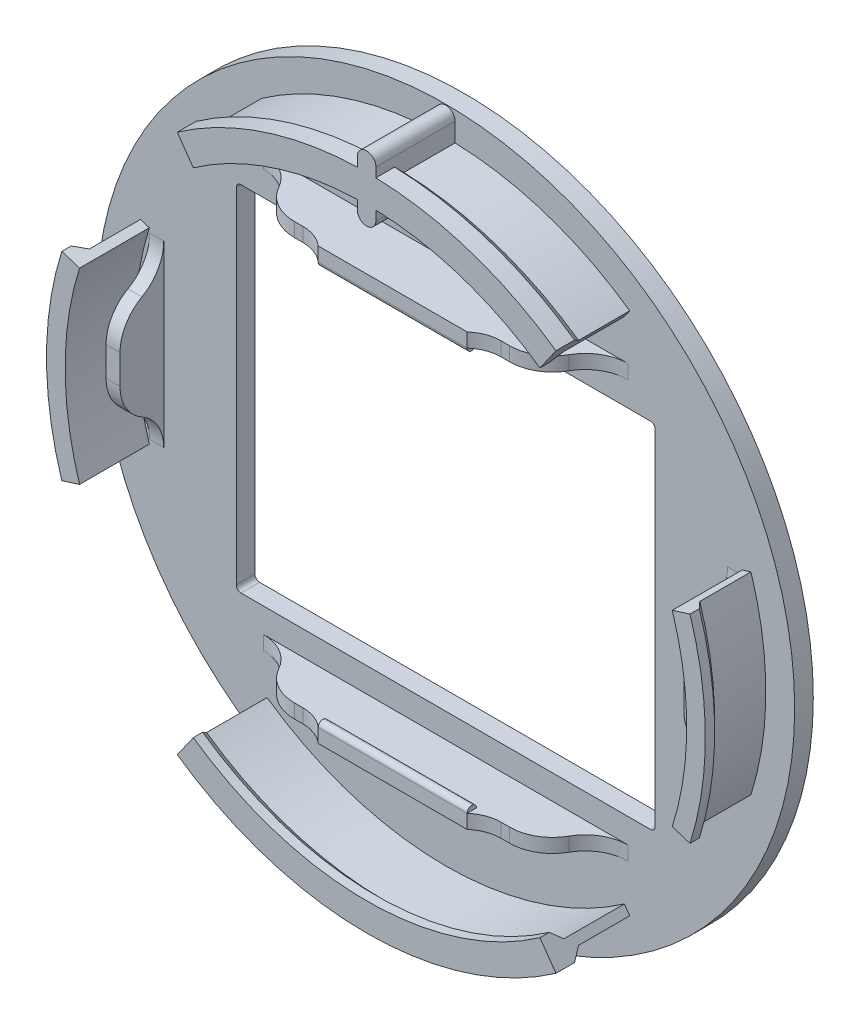
from build123d import *

# Parameters (mm, degrees)
ESQUISSE1_R        = 37.50000000000001
BOSS_EXTRU_1_DEPTH = 2
ESQUISSE2_W        = 30.000000000000004
ESQUISSE2_H        = 1.4999999999999964
ESQUISSE2_W_2      = 1.5
ESQUISSE2_H_2      = 10
EXTRU_MINCE1_DEPTH = 4.7
ESQUISSE5_W        = 16
ESQUISSE5_H        = 2.0000000000000036
BOSS_EXTRU_3_DEPTH = 1
CONG_5_R           = 0.5
CONG_6_R           = 0.5
CONG_1_R           = 4.6
CONG_2_R           = 4.6
EXTRU_MINCE2_DEPTH = 6.5
BOSS_EXTRU_2_DEPTH = 1
BOSS_EXTRU_5_DEPTH = 1
BOSS_EXTRU_4_DEPTH = 8.5
CHANFREIN1_SIZE    = 1
CONG_7_R           = 4


# Some blends are built 0.0001 mm under size
with BuildPart() as part:
    # Esquisse1 → Boss.-Extru.1 (new body)
    with BuildSketch(Plane.XY):
        Circle(ESQUISSE1_R)
        with BuildLine():
            Line((-21.999999999999996, -18.999999999999996), (22.000000000000004, -18.999999999999996))
            ThreePointArc((22.000000000000004, -18.999999999999996), (22.353553390593277, -18.85355339059327), (22.500000000000004, -18.499999999999996))
            Line((22.500000000000004, -18.499999999999996), (22.500000000000004, 18.500000000000004))
            ThreePointArc((22.500000000000004, 18.500000000000004), (22.353553390593277, 18.853553390593277), (22.000000000000004, 19.000000000000004))
            Line((22.000000000000004, 19.000000000000004), (-21.999999999999996, 19.000000000000004))
            ThreePointArc((-21.999999999999996, 19.000000000000004), (-22.35355339059327, 18.853553390593277), (-22.499999999999996, 18.500000000000004))
            Line((-22.499999999999996, 18.500000000000004), (-22.499999999999996, -18.499999999999996))
            ThreePointArc((-22.499999999999996, -18.499999999999996), (-22.35355339059327, -18.85355339059327), (-21.999999999999996, -18.999999999999996))
        make_face(mode=Mode.SUBTRACT)
    extrude(amount=BOSS_EXTRU_1_DEPTH)

    # Esquisse2 → Extru.-Mince1 (add)
    with BuildSketch(Plane.XY.offset(2)):
        with Locations((0, 22.4)):
            Rectangle(ESQUISSE2_W, ESQUISSE2_H)
        with Locations((31.05, 0)):
            Rectangle(ESQUISSE2_W_2, ESQUISSE2_H_2)
        with Locations((-31.05, 0)):
            Rectangle(ESQUISSE2_W_2, ESQUISSE2_H_2)
        with Locations((0, -22.4)):
            Rectangle(ESQUISSE2_W, ESQUISSE2_H)
    extrude(amount=EXTRU_MINCE1_DEPTH)

    # Esquisse5 → Boss.-Extru.3 (add)
    with BuildSketch(Plane.XY.offset(6.7)):
        with Locations((0, 22.15)):
            Rectangle(ESQUISSE5_W, ESQUISSE5_H)
        with Locations((0, -22.15)):
            Rectangle(ESQUISSE5_W, ESQUISSE5_H)
    extrude(amount=BOSS_EXTRU_3_DEPTH)

    # Congé5
    # the kernel refuses this fillet: 0.5 mm, written as the material it takes off along each edge
    with BuildSketch(Plane(origin=(9.25, 21.15, 6.7), x_dir=(0, 1, 0), z_dir=(-1, 0, 0))) as cong_5_piece_1:
        with BuildLine():
            CenterArc((CONG_5_R, -CONG_5_R), CONG_5_R, 90, 90)
            Line((0, -CONG_5_R), (0, 0))
            Line((0, 0), (CONG_5_R, 0))
        make_face()
    extrude(amount=18.5, mode=Mode.SUBTRACT)
    with BuildSketch(Plane(origin=(9.25, 21.15, 7.7), x_dir=(0, 0, -1), z_dir=(-1, 0, 0))) as cong_5_piece_2:
        with BuildLine():
            CenterArc((CONG_5_R, -CONG_5_R), CONG_5_R, 90, 90)
            Line((0, -CONG_5_R), (0, 0))
            Line((0, 0), (CONG_5_R, 0))
        make_face()
    extrude(amount=18.5, mode=Mode.SUBTRACT)

    # Congé6
    # the kernel refuses this fillet: 0.5 mm, written as the material it takes off along each edge
    with BuildSketch(Plane(origin=(9.25, -21.15, 6.7), x_dir=(0, -1, 0), z_dir=(-1, 0, 0))) as cong_6_piece_1:
        with BuildLine():
            CenterArc((CONG_6_R, CONG_6_R), CONG_6_R, 180, 90)
            Line((0, CONG_6_R), (0, 0))
            Line((0, 0), (CONG_6_R, 0))
        make_face()
    extrude(amount=18.5, mode=Mode.SUBTRACT)
    with BuildSketch(Plane(origin=(9.25, -21.15, 7.7), x_dir=(0, -1, 0), z_dir=(-1, 0, 0))) as cong_6_piece_2:
        with BuildLine():
            CenterArc((CONG_6_R, -CONG_6_R), CONG_6_R, 90, 90)
            Line((0, -CONG_6_R), (0, 0))
            Line((0, 0), (CONG_6_R, 0))
        make_face()
    extrude(amount=18.5, mode=Mode.SUBTRACT)

    # Congé1
    cong_1_edges = [part.edges().sort_by_distance(p)[0] for p in [
        (-15, 22.4, 2),
        (15, 22.4, 2),
        (31.05, -5, 2),
        (31.05, 5, 2),
        (-31.05, -5, 2),
        (-31.05, 5, 2),
        (-15, -22.4, 2),
        (15, -22.4, 2),
    ]]
    fillet(cong_1_edges, radius=CONG_1_R)

    # Congé2
    cong_2_edges = [part.edges().sort_by_distance(p)[0] for p in [
        (15, 22.4, 6.7),
        (31.05, 5, 6.7),
        (31.05, -5, 6.7),
        (15, -22.4, 6.7),
        (-15, -22.4, 6.7),
        (-31.05, 5, 6.7),
        (-31.05, -5, 6.7),
        (-15, 22.4, 6.7),
    ]]
    fillet(cong_2_edges, radius=CONG_2_R)

    # Esquisse3 → Extru.-Mince2 (add)
    with BuildSketch(Plane.XY.offset(2)):
        with BuildLine():
            ThreePointArc((-32.80000000000001, 10.369185117452545), (-34.4, 4.21e-15), (-32.80000000000001, -10.369185117452545))
            Line((-32.80000000000001, -10.369185117452545), (-31.84651162790699, -10.0677553175266))
            ThreePointArc((-31.84651162790699, -10.0677553175266), (-33.4, -4.09e-15), (-31.84651162790699, 10.0677553175266))
            Line((-31.84651162790699, 10.0677553175266), (-32.80000000000001, 10.369185117452545))
        make_face()
        with BuildLine():
            ThreePointArc((-19.772139489696098, -28.150000000000002), (2.11e-15, -34.4), (19.772139489696098, -28.150000000000002))
            Line((19.772139489696098, -28.150000000000002), (19.197367992902606, -27.33168604651163))
            ThreePointArc((19.197367992902606, -27.33168604651163), (2.05e-15, -33.4), (-19.197367992902606, -27.33168604651163))
            Line((-19.197367992902606, -27.33168604651163), (-19.772139489696098, -28.150000000000002))
        make_face()
        with BuildLine():
            ThreePointArc((32.80000000000001, -10.369185117452545), (34.4, 0), (32.80000000000001, 10.369185117452545))
            Line((32.80000000000001, 10.369185117452545), (31.84651162790699, 10.0677553175266))
            ThreePointArc((31.84651162790699, 10.0677553175266), (33.4, 0), (31.84651162790699, -10.0677553175266))
            Line((31.84651162790699, -10.0677553175266), (32.80000000000001, -10.369185117452545))
        make_face()
        with BuildLine():
            ThreePointArc((19.772139489696105, 28.15), (2.11e-15, 34.4), (-19.772139489696105, 28.15))
            Line((-19.772139489696105, 28.15), (-19.197367992902613, 27.331686046511628))
            ThreePointArc((-19.197367992902613, 27.331686046511628), (-5.37e-15, 33.4), (19.197367992902613, 27.331686046511628))
            Line((19.197367992902613, 27.331686046511628), (19.772139489696105, 28.15))
        make_face()
    extrude(amount=EXTRU_MINCE2_DEPTH)

    # Esquisse4 → Boss.-Extru.2 (add)
    with BuildSketch(Plane.XY.offset(8.5)):
        with BuildLine():
            Line((-19.197367992902617, 27.331686046511624), (-20.3469109864896, 28.96831395348837))
            ThreePointArc((-20.3469109864896, 28.96831395348837), (-5.69e-15, 35.400000000000006), (20.346910986489593, 28.968313953488376))
            Line((20.346910986489593, 28.968313953488376), (19.19736799290261, 27.331686046511624))
            ThreePointArc((19.19736799290261, 27.331686046511624), (2.05e-15, 33.4), (-19.197367992902617, 27.331686046511624))
        make_face()
        with BuildLine():
            Line((33.75348837209304, 10.67061491737849), (31.84651162790699, 10.067755317526597))
            ThreePointArc((31.84651162790699, 10.067755317526597), (33.4, -3.71e-15), (31.846511627906985, -10.067755317526604))
            Line((31.846511627906985, -10.067755317526604), (33.753488372093045, -10.670614917378492))
            ThreePointArc((33.753488372093045, -10.670614917378492), (35.40000000000001, 0), (33.75348837209304, 10.67061491737849))
        make_face()
        with BuildLine():
            Line((19.197367992902603, -27.331686046511635), (20.346910986489593, -28.968313953488376))
            ThreePointArc((20.346910986489593, -28.968313953488376), (1.003e-14, -35.4), (-20.34691098648957, -28.96831395348839))
            Line((-20.34691098648957, -28.96831395348839), (-19.197367992902635, -27.33168604651161))
            ThreePointArc((-19.197367992902635, -27.33168604651161), (-2.762e-14, -33.4), (19.197367992902603, -27.331686046511635))
        make_face()
        with BuildLine():
            Line((-31.846511627906985, -10.067755317526593), (-33.75348837209304, -10.670614917378492))
            ThreePointArc((-33.75348837209304, -10.670614917378492), (-35.40000000000001, 4.34e-15), (-33.753488372093045, 10.67061491737849))
            Line((-33.753488372093045, 10.67061491737849), (-31.846511627906985, 10.067755317526604))
            ThreePointArc((-31.846511627906985, 10.067755317526604), (-33.4, 4.09e-15), (-31.846511627906985, -10.067755317526593))
        make_face()
    extrude(amount=BOSS_EXTRU_2_DEPTH)

    # Esquisse8 → Boss.-Extru.5 (add)
    with BuildSketch(Plane.XY.offset(9.500000000000002)):
        with BuildLine():
            Line((20.34691098648959, -28.96831395348837), (18.622596496109104, -26.513372093023264))
            ThreePointArc((18.622596496109104, -26.513372093023264), (-4.118e-14, -32.4), (-18.622596496109168, -26.513372093023218))
            Line((-18.622596496109168, -26.513372093023218), (-20.34691098648957, -28.96831395348839))
            ThreePointArc((-20.34691098648957, -28.96831395348839), (1.003e-14, -35.4), (20.34691098648959, -28.96831395348837))
        make_face()
        with BuildLine():
            Line((-20.346910986489604, 28.968313953488373), (-18.622596496109125, 26.51337209302325))
            ThreePointArc((-18.622596496109125, 26.51337209302325), (1.98e-15, 32.4), (18.622596496109125, 26.513372093023253))
            Line((18.622596496109125, 26.513372093023253), (20.346910986489593, 28.968313953488384))
            ThreePointArc((20.346910986489593, 28.968313953488384), (-1.355e-14, 35.40000000000001), (-20.346910986489604, 28.968313953488373))
        make_face()
    extrude(amount=BOSS_EXTRU_5_DEPTH)

    # Esquisse7 → Boss.-Extru.4 (add)
    with BuildSketch(Plane.XY.offset(2)):
        with BuildLine():
            Line((0.9999999999999993, 36.400000000000006), (1.0000000000000009, 31.400000000000006))
            ThreePointArc((1.0000000000000009, 31.400000000000006), (-1.8e-16, 30.400000000000006), (-0.9999999999999996, 31.400000000000006))
            Line((-0.9999999999999996, 31.400000000000006), (-1.000000000000001, 36.400000000000006))
            ThreePointArc((-1.000000000000001, 36.400000000000006), (-1.47e-15, 37.400000000000006), (0.9999999999999993, 36.400000000000006))
        make_face()
    extrude(amount=BOSS_EXTRU_4_DEPTH)

    # Chanfrein1
    chanfrein1_edges = [part.edges().sort_by_distance(p)[0] for p in [
        (10.843924173071517, 32.64612241183745, 8.5),
        (-3.55e-15, -34.39999999999999, 8.5),
        (34.400000000000006, 4e-15, 8.5),
        (-34.4, -8.9e-16, 8.5),
        (-10.542492654739178, 31.692520389277497, 9.5),
        (-1.776e-14, -33.39999999999999, 9.5),
        (10.542492654739181, 31.692520389277497, 9.5),
        (-10.843924173071517, 32.64612241183745, 8.5),
    ]]
    chamfer(chanfrein1_edges, length=CHANFREIN1_SIZE - 0.0001)  # a hair under: the kernel refuses the full size

    # Congé7
    # the kernel refuses this fillet: 4 mm, written as the material it adds along each edge
    with BuildSketch(Plane(origin=(8, -23.150000000000002, 6.7), x_dir=(1, 0, -3.4e-16), z_dir=(0, 1, 0)), Plane(origin=(-8, -21.65, 6.7), x_dir=(-1, 0, -3.4e-16), z_dir=(0, -1, 0))) as cong_7_piece_1:
        with BuildLine():
            CenterArc((2.645751311064592, -4), CONG_7_R, 89.99999999999999, 41.4096221092709)
            Line((-3.4e-16, -1.0000000000000009), (0, 0))
            Line((0, 0), (2.6457513110645934, 0))
        make_face()
    extrude(amount=1.5000000000000036)
    with BuildSketch(Plane(origin=(-8, 21.65, 6.7), x_dir=(0, 0, 1), z_dir=(0, 1, 0))) as cong_7_piece_2:
        with BuildLine():
            CenterArc((3.999999999999999, -2.6457513110645934), CONG_7_R, 138.5903778907291, 41.40962210927091)
            Line((-8.9e-16, -2.6457513110645934), (0, 0))
            Line((0, 0), (1.0000000000000009, 0))
        make_face()
    extrude(amount=1.5000000000000036)
    with BuildSketch(Plane(origin=(8, 23.150000000000002, 6.7), x_dir=(1, 0, -3.4e-16), z_dir=(0, -1, 0))) as cong_7_piece_3:
        with BuildLine():
            CenterArc((2.645751311064592, 4), CONG_7_R, 228.59037789072912, 41.40962210927091)
            Line((-3.4e-16, 1.0000000000000009), (0, 0))
            Line((0, 0), (2.6457513110645934, 0))
        make_face()
    extrude(amount=1.5000000000000036)


solid = part.part
